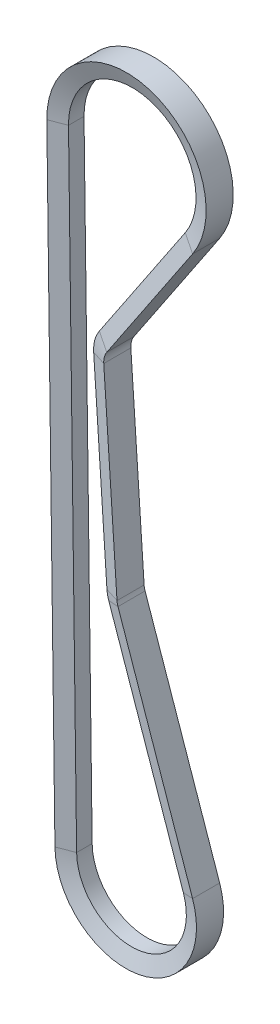
from build123d import *


with BuildPart() as part:
    # Sweep1: sweep along a path in Sketch2
    with BuildLine(Plane.XY) as sweep1_path:
        Line((-24.872904537, -0.322872384), (-27.728171194, 219.636400727))
        ThreePointArc((-27.728171194, 219.636400727), (8.242025122, 246.840817918), (23.528979753, 204.411531383))
        Line((23.528979753, 204.411531383), (-6.653400815, 159.376010378))
        ThreePointArc((-6.653400815, 159.376010378), (-7.511930091, 157.484960469), (-7.714387475, 155.41804168))
        Line((-7.714387475, 155.41804168), (-3.053995443, 85.573351502))
        ThreePointArc((-3.053995443, 85.573351502), (-2.941640545, 84.735224206), (-2.718916826, 83.919457615))
        Line((-2.718916826, 83.919457615), (23.507198462, 8.1349399))
        ThreePointArc((23.507198462, 8.1349399), (4.283682461, -24.503381221), (-24.872904537, -0.322872384))
    # Sketch3 → Sweep1 (sweep)
    with BuildSketch(Plane(origin=(23.507198462, 8.1349399, 0), x_dir=(-0.9450130021925869, -0.3270327593482861, 0), z_dir=(0.3270327593482861, -0.9450130021925869, 0))):
        Polygon((0, -4.7625), (0, 4.7625), (5.588, 2.728634331), (5.588, -2.728634331), align=None)
    sweep(path=sweep1_path.line)


solid = part.part
